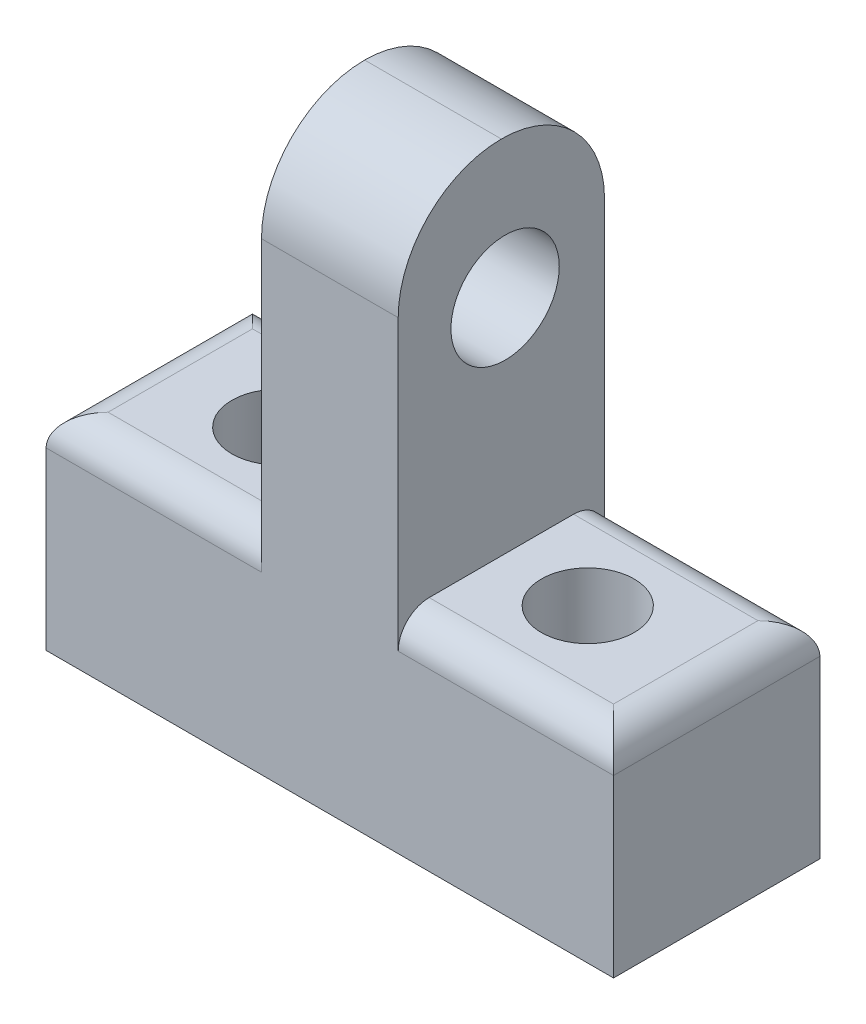
from build123d import *

# Parameters (mm, degrees)
SKETCH_1_W          = 55
SKETCH_1_H          = 20
SKETCH_1_R          = 4.5
EXTRUDE_1_DEPTH     = 20
EXTRUDE_START       = -10
EXTRUDE_2_OUTLINE_W = 13.25368731
EXTRUDE_2_OUTLINE_H = 35
EXTRUDE_2_DEPTH     = 20
SKETCH_3_R          = 5.25
CUT_EXTRUDE_1_DEPTH = 30
FILLET1_R           = 10
FILLET2_R           = 3
FILLET3_R           = 3


# Read off the part's stored shape, not the designer's step: 填料-伸長2
with BuildPart() as part:
    # 草圖1 → 填料-伸長1 (new body)
    with BuildSketch(Plane(origin=(0, 0, 0), x_dir=(1, 0, 0), z_dir=(0, 1, 0))):
        Rectangle(SKETCH_1_W, SKETCH_1_H)
        with Locations(Location((-15, 0, 0), (0, 0, 270))):
            Circle(SKETCH_1_R, mode=Mode.SUBTRACT)
        with Locations(Location((15, 0, 0), (0, 0, 90))):
            Circle(SKETCH_1_R, mode=Mode.SUBTRACT)
    extrude(amount=EXTRUDE_1_DEPTH)

    # 填料-伸長2 outline → 填料-伸長2 (add)
    with BuildSketch(Plane.XY.offset(EXTRUDE_START)):
        with Locations((0, 37.5)):
            Rectangle(EXTRUDE_2_OUTLINE_W, EXTRUDE_2_OUTLINE_H)
    extrude(amount=EXTRUDE_2_DEPTH)

    # 草圖3 → 除料-伸長1 (cut)
    with BuildSketch(Plane(origin=(6.626843655, 0, 0), x_dir=(0, 0, -1), z_dir=(1, 0, 0))):
        with Locations((0.362292653, 41.5)):
            Circle(SKETCH_3_R)
    extrude(amount=-CUT_EXTRUDE_1_DEPTH, mode=Mode.SUBTRACT)

    # Fillet1
    fillet1_edges = [part.edges().sort_by_distance(p)[0] for p in [
        (0, 55, -10),
        (0, 55, 10),
    ]]
    fillet(fillet1_edges, radius=FILLET1_R - 0.0001)  # a hair under: the kernel refuses the full size

    # Fillet2
    fillet2_edges = [part.edges().sort_by_distance(p)[0] for p in [
        (-27.5, 20, 0),
        (-17.063421827, 20, 10),
        (-17.063421827, 20, -10),
    ]]
    fillet(fillet2_edges, radius=FILLET2_R)

    # Fillet3
    fillet3_edges = [part.edges().sort_by_distance(p)[0] for p in [
        (17.063421827, 20, 10),
        (27.5, 20, 0),
        (17.063421828, 20, -10),
    ]]
    fillet(fillet3_edges, radius=FILLET3_R)


solid = part.part
